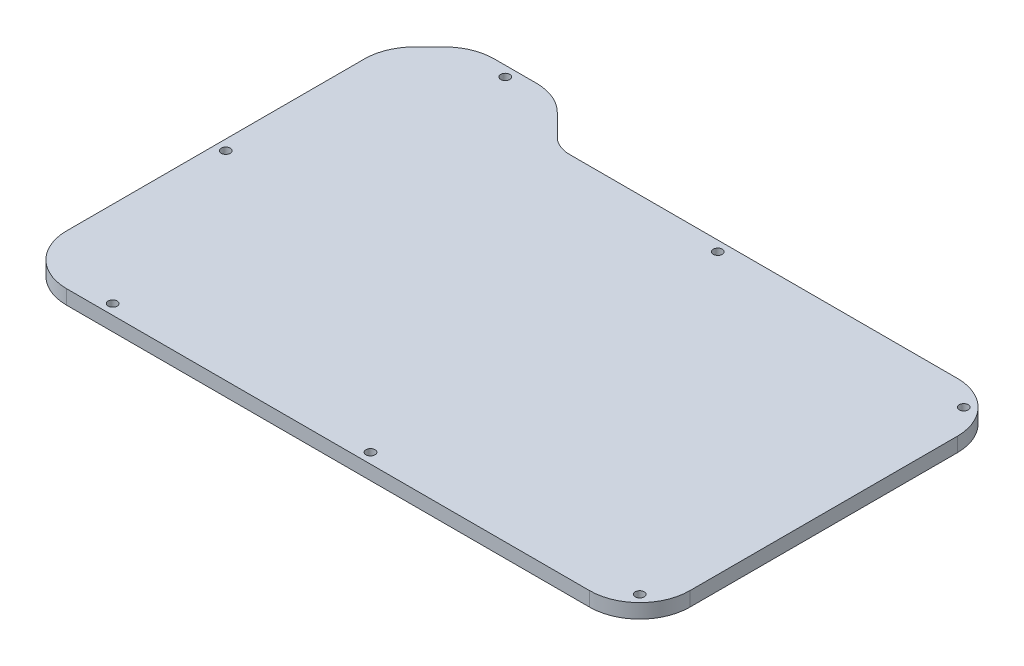
from build123d import *

# Parameters (mm, degrees)
SKETCH1_R           = 1
BOSS_EXTRUDE1_DEPTH = 3.175


with BuildPart() as part:
    # Sketch1 → Boss-Extrude1 (new body)
    with BuildSketch(Plane(origin=(0, 0, 0), x_dir=(1, 0, 0), z_dir=(0, 1, 0))):
        with BuildLine():
            Line((11.99093556, 30.046212878), (-73.957740507, 30.046212878))
            ThreePointArc((-73.957740507, 30.046212878), (-76.48345116, 30.548607964), (-78.624645263, 31.979308122))
            Line((-78.624645263, 31.979308122), (-83.44043529, 36.795098149))
            ThreePointArc((-83.44043529, 36.795098149), (-87.041534462, 39.201275689), (-91.289320561, 40.046212878))
            Line((-91.289320561, 40.046212878), (-100.652322598, 40.046212878))
            ThreePointArc((-100.652322598, 40.046212878), (-104.900108697, 39.201275689), (-108.501207869, 36.795098149))
            Line((-108.501207869, 36.795098149), (-111.78146399, 33.514842028))
            ThreePointArc((-111.78146399, 33.514842028), (-114.18764153, 29.913742856), (-115.032578719, 25.665956757))
            Line((-115.032578719, 25.665956757), (-115.032578719, -40.353787122))
            ThreePointArc((-115.032578719, -40.353787122), (-111.78146399, -48.202672393), (-103.932578719, -51.453787122))
            Line((-103.932578719, -51.453787122), (11.99093556, -51.453787122))
            ThreePointArc((11.99093556, -51.453787122), (19.839820831, -48.202672393), (23.09093556, -40.353787122))
            Line((23.09093556, -40.353787122), (23.09093556, 18.946212878))
            ThreePointArc((23.09093556, 18.946212878), (19.839820831, 26.795098149), (11.99093556, 30.046212878))
        make_face()
        with Locations((-95.970821579, 37.796212878)):
            Circle(SKETCH1_R, mode=Mode.SUBTRACT)
        with Locations((-95.970821579, -49.203787122)):
            Circle(SKETCH1_R, mode=Mode.SUBTRACT)
        with Locations((-38.860995503, -49.180760875)):
            Circle(SKETCH1_R, mode=Mode.SUBTRACT)
        with Locations((18.248830574, -46.611682135)):
            Circle(SKETCH1_R, mode=Mode.SUBTRACT)
        with Locations((18.248830574, 25.204107892)):
            Circle(SKETCH1_R, mode=Mode.SUBTRACT)
        with Locations((-38.860995503, 27.796212878)):
            Circle(SKETCH1_R, mode=Mode.SUBTRACT)
        with Locations((-112.782578719, -7.343915182)):
            Circle(SKETCH1_R, mode=Mode.SUBTRACT)
    extrude(amount=BOSS_EXTRUDE1_DEPTH)


solid = part.part
